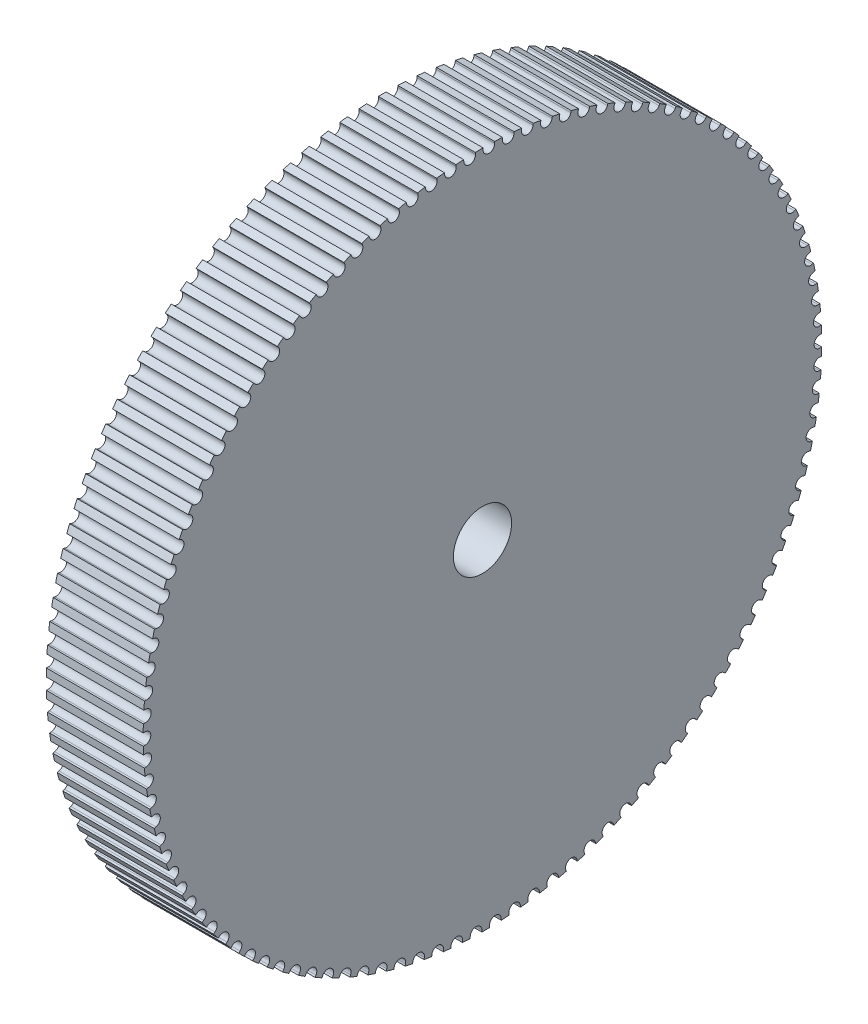
from build123d import *

# Parameters (mm, degrees)
SKETCH1_R           = 35
SKETCH1_R_2         = 3
BOSS_EXTRUDE1_DEPTH = 10
CUT_EXTRUDE1_DEPTH  = 10
CIRPATTERN1_COUNT   = 110


with BuildPart() as part:
    # Sketch1 → Boss-Extrude1 (new body)
    with BuildSketch(Plane(origin=(0, 0, 0), x_dir=(0, 0, -1), z_dir=(1, 0, 0))):
        Circle(SKETCH1_R)
        Circle(SKETCH1_R_2, mode=Mode.SUBTRACT)
    extrude(amount=BOSS_EXTRUDE1_DEPTH)

    # Sketch2 → Cut-Extrude1 (cut)
    with BuildSketch(Plane(origin=(10, 0, 0), x_dir=(0, 0, -1), z_dir=(1, 0, 0))):
        with BuildLine():
            Line((1.261244797, 35.693567752), (1.261244797, 34.808482345))
            ThreePointArc((1.261244797, 34.808482345), (0.661244797, 34.208482345), (0.061244797, 34.808482345))
            Line((0.061244797, 34.808482345), (0.061244797, 35.693567752))
            ThreePointArc((0.061244797, 35.693567752), (0.661244797, 36.293567752), (1.261244797, 35.693567752))
        make_face()
    cut_extrude1 = extrude(amount=-CUT_EXTRUDE1_DEPTH, mode=Mode.SUBTRACT)

    # CirPattern1: Cut-Extrude1 ×110 about axis
    cirpattern1_axis = Axis((10, 0, 0), (1, 0, 0))
    for i in range(1, CIRPATTERN1_COUNT):
        add(cut_extrude1.rotate(cirpattern1_axis, i * 360 / CIRPATTERN1_COUNT), mode=Mode.SUBTRACT)


solid = part.part
